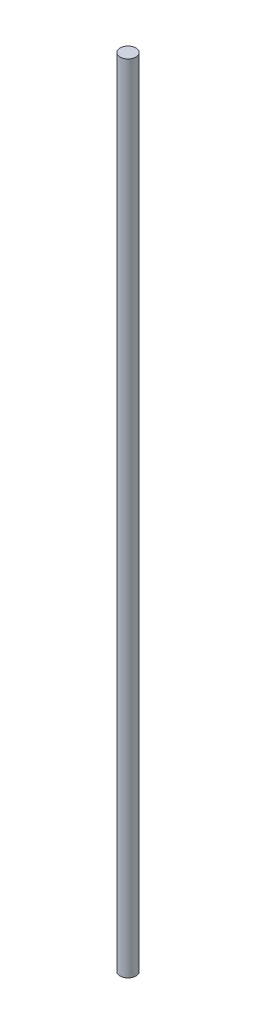
from build123d import *

# Parameters (mm, degrees)
SKETCH1_R           = 0.5
BOSS_EXTRUDE1_DEPTH = 50


with BuildPart() as part:
    # Sketch1 → Boss-Extrude1 (new body)
    with BuildSketch(Plane(origin=(0, 0, 0), x_dir=(1, 0, 0), z_dir=(0, 1, 0))):
        Circle(SKETCH1_R)
    extrude(amount=BOSS_EXTRUDE1_DEPTH)


solid = part.part
